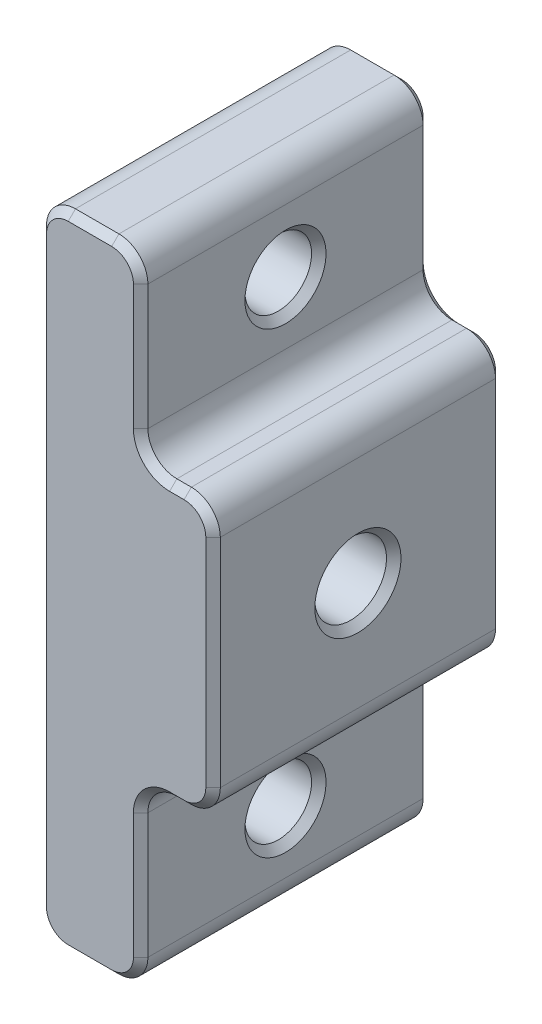
from build123d import *

# Parameters (mm, degrees)
AUFSATZ_LINEAR_AUSTRAGEN1_DEPTH = 20
SKIZZE2_R                       = 2.475
SCHNITT_LINEAR_AUSTRAGEN1_DEPTH = 20
SKIZZE3_R                       = 4.75
SCHNITT_LINEAR_AUSTRAGEN2_DEPTH = 6.55
SKIZZE4_R                       = 2.3
SCHNITT_LINEAR_AUSTRAGEN3_DEPTH = 10
VERRUNDUNG1_R                   = 2
FASE1_SIZE                      = 0.5


with BuildPart() as part:
    # Skizze1 → Aufsatz-Linear austragen1 (new body)
    with BuildSketch(Plane.XY):
        Polygon((0, -22.130332374), (0, 22.130332374), (7, 22.130332374), (7, 9.485781443), (12, 9.485781443), (12, -9.485781443), (7, -9.485781443), (7, -22.130332374), align=None)
    extrude(amount=AUFSATZ_LINEAR_AUSTRAGEN1_DEPTH)

    # Skizze2 → Schnitt-Linear austragen1 (cut)
    with BuildSketch(Plane(origin=(12, 0, 0), x_dir=(0, 0, -1), z_dir=(1, 0, 0))):
        with Locations((-10, 0)):
            Circle(SKIZZE2_R)
    extrude(amount=-SCHNITT_LINEAR_AUSTRAGEN1_DEPTH, mode=Mode.SUBTRACT)

    # Skizze3 → Schnitt-Linear austragen2 (cut)
    with BuildSketch(Plane.ZY):
        with Locations((10, 0)):
            Circle(SKIZZE3_R)
    extrude(amount=-SCHNITT_LINEAR_AUSTRAGEN2_DEPTH, mode=Mode.SUBTRACT)

    # Skizze4 → Schnitt-Linear austragen3 (cut)
    with BuildSketch(Plane(origin=(7, 0, 0), x_dir=(0, 0, -1), z_dir=(1, 0, 0))):
        with Locations((-10, -15.808056909)):
            Circle(SKIZZE4_R)
        with Locations((-10, 15.808056909)):
            Circle(SKIZZE4_R)
    extrude(amount=-SCHNITT_LINEAR_AUSTRAGEN3_DEPTH, mode=Mode.SUBTRACT)

    # Verrundung1
    verrundung1_edges = [part.edges().sort_by_distance(p)[0] for p in [
        (0, 22.130332374, 10),
        (7, -9.485781443, 10),
        (7, 22.130332374, 10),
        (7, 9.485781443, 10),
        (12, 9.485781443, 10),
        (12, -9.485781443, 10),
        (7, -22.130332374, 10),
        (0, -22.130332374, 10),
    ]]
    fillet(verrundung1_edges, radius=VERRUNDUNG1_R)

    # Fase1
    fase1_edges = [part.edges().sort_by_distance(p)[0] for p in [
        (0, 15.808056909, 12.3),
        (7, 15.808056909, 12.3),
        (6.55, 0, 12.475),
        (12, 0, 12.475),
        (0, -15.808056909, 12.3),
        (7, -15.808056909, 12.3),
        (7, -15.808056909, 20),
        (3.5, -22.130332374, 20),
        (0, 0, 20),
        (3.5, 22.130332374, 20),
        (7, 15.808056909, 20),
        (9.5, 9.485781443, 20),
        (12, 0, 20),
        (9.5, -9.485781443, 20),
        (12, 0, 0),
        (9.5, 9.485781443, 0),
        (7, 15.808056909, 0),
        (3.5, 22.130332374, 0),
        (0, 0, 0),
        (3.5, -22.130332374, 0),
        (7, -15.808056909, 0),
        (9.5, -9.485781443, 0),
        (0, 0, 5.25),
        (6.414213562, 21.544545937, 20),
        (7.585786438, 10.071567881, 20),
        (11.414213562, 8.899995006, 20),
        (11.414213562, -8.899995006, 20),
        (7.585786438, -10.071567881, 20),
        (6.414213562, -21.544545937, 20),
        (0.585786438, -21.544545937, 20),
        (0.585786438, 21.544545937, 20),
        (0.585786438, -21.544545937, 0),
        (6.414213562, -21.544545937, 0),
        (7.585786438, -10.071567881, 0),
        (11.414213562, -8.899995006, 0),
        (11.414213562, 8.899995006, 0),
        (7.585786438, 10.071567881, 0),
        (6.414213562, 21.544545937, 0),
        (0.585786438, 21.544545937, 0),
    ]]
    chamfer(fase1_edges, length=FASE1_SIZE)


solid = part.part
